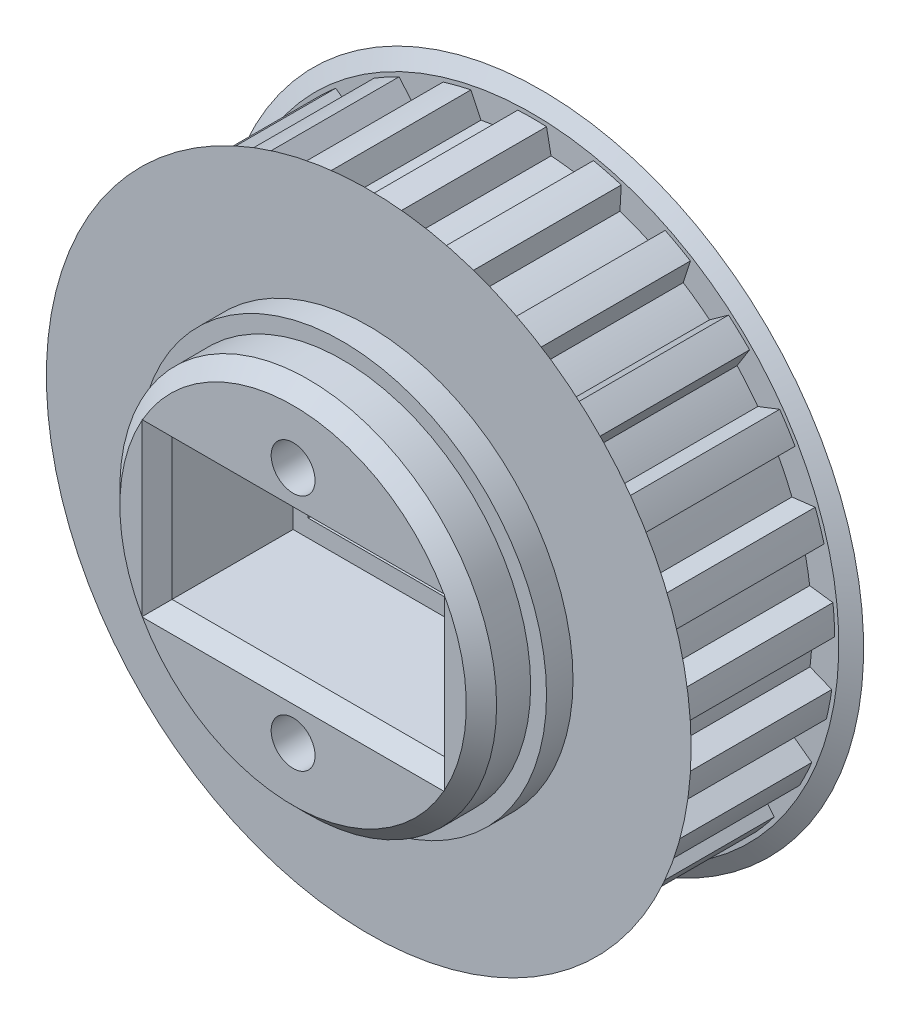
from build123d import *
from build123d.topology import SkipClean

# Parameters (mm, degrees)
CROQUIS1_R                 = 1.5
SALIENTE_EXTRUIR1_DEPTH    = 10.2
CROQUIS2_R                 = 22
CROQUIS2_R_2               = 1.5
SALIENTE_EXTRUIR2_DEPTH    = 0.6
SALIENTE_EXTRUIR4_START    = 4.25
CROQUIS4_R                 = 12.45
CROQUIS4_R_2               = 1.5
SALIENTE_EXTRUIR4_DEPTH    = 4.25
SALIENTE_EXTRUIR6_START    = 0.6
CROQUIS6_R                 = 22
CROQUIS6_R_2               = 1.5
SALIENTE_EXTRUIR6_DEPTH    = 0.6
SALIENTE_EXTRUIR5_START    = 1.75
CROQUIS5_R                 = 13.5
CROQUIS5_R_2               = 1.5
SALIENTE_EXTRUIR5_DEPTH    = 1.75
CHAFL_N2_SIZE              = 1.732050808
CHAFL_N2_SIZE_2            = 1
CROQUIS3_R                 = 12.45
CROQUIS3_R_2               = 1.5
SALIENTE_EXTRUIR7_DEPTH    = 5
CHAFL_N4_SIZE              = 1
CROQUIS7_R                 = 13.5
CROQUIS7_R_2               = 1.5
SALIENTE_EXTRUIR8_DEPTH    = 1.75
CORTAR_EXTRUIR1_DEPTH      = 35.023988766
CORTAR_EXTRUIR1_DEPTH_BACK = 35.023988766
CROQUIS8_R                 = 1.45
CROQUIS8_W                 = 16
CROQUIS8_H                 = 7
CROQUIS10_W                = 18
CROQUIS10_H                = 9.3
CORTAR_EXTRUIR3_DEPTH      = 9
CHAFL_N5_SIZE              = 1
SKETCH1_R                  = 12.45
SKETCH1_R_2                = 1.45
BOSS_EXTRUDE1_DEPTH        = 5
SKETCH2_R                  = 1.45
CUT_EXTRUDE1_DEPTH         = 37.193843559
SKETCH4_W                  = 8
SKETCH4_H                  = 7
CUT_EXTRUDE2_DEPTH         = 21
CHAMFER3_SIZE              = 1
CHAMFER2_SIZE              = 0.75


# Some blends are built 0.0001 mm under size
with BuildPart() as part:
    # Croquis1 → Saliente-Extruir1 (new body)
    with BuildSketch(Plane.XY):
        with BuildLine():
            Line((-0.95, 19.977424759), (-1.25, 18.457721961))
            ThreePointArc((-1.25, 18.457721961), (-2.318664821, 18.354121974), (-3.37951984, 18.188701043))
            Line((-3.37951984, 18.188701043), (-4.048029506, 19.586052617))
            ThreePointArc((-4.048029506, 19.586052617), (-4.973797743, 19.371663223), (-5.888337512, 19.113541831))
            Line((-5.888337512, 19.113541831), (-5.800977743, 17.566976326))
            ThreePointArc((-5.800977743, 17.566976326), (-6.810304225, 17.200864989), (-7.79669202, 16.776817146))
            Line((-7.79669202, 16.776817146), (-8.791706431, 17.964016757))
            ThreePointArc((-8.791706431, 17.964016757), (-9.635073482, 17.526133601), (-10.456689123, 17.048684776))
            Line((-10.456689123, 17.048684776), (-9.98745872, 15.57243296))
            ThreePointArc((-9.98745872, 15.57243296), (-10.874027167, 14.966814396), (-11.723969366, 14.310784126))
            Line((-11.723969366, 14.310784126), (-12.982968107, 15.213235657))
            ThreePointArc((-12.982968107, 15.213235657), (-13.690942119, 14.579372548), (-14.368008499, 13.912596155))
            Line((-14.368008499, 13.912596155), (-13.546390935, 12.599416361))
            ThreePointArc((-13.546390935, 12.599416361), (-14.254494991, 11.79234381), (-14.914586599, 10.945551908))
            Line((-14.914586599, 10.945551908), (-16.358462148, 11.50655101))
            ThreePointArc((-16.358462148, 11.50655101), (-16.88655851, 10.7165359), (-17.376533059, 9.902327951))
            Line((-17.376533059, 9.902327951), (-16.254153587, 8.834732094))
            ThreePointArc((-16.254153587, 8.834732094), (-16.739300471, 7.876916894), (-17.168065504, 6.892570409))
            Line((-17.168065504, 6.892570409), (-18.706093851, 7.076867445))
            ThreePointArc((-18.706093851, 7.076867445), (-19.021130326, 6.180339887), (-19.29322614, 5.269860064))
            Line((-19.29322614, 5.269860064), (-17.94060799, 4.514929118))
            ThreePointArc((-17.94060799, 4.514929118), (-18.172314138, 3.46655432), (-18.342811714, 2.406503362))
            Line((-18.342811714, 2.406503362), (-19.878352881, 2.202518271))
            ThreePointArc((-19.878352881, 2.202518271), (-19.960534569, 1.255810391), (-19.997654868, 0.306267487))
            Line((-19.997654868, 0.306267487), (-18.499788013, -0.088563459))
            ThreePointArc((-18.499788013, -0.088563459), (-18.463494476, -1.161624611), (-18.365011603, -2.230773142))
            Line((-18.365011603, -2.230773142), (-19.801581892, -2.810223225))
            ThreePointArc((-19.801581892, -2.810223225), (-19.645745015, -3.747626292), (-19.445557394, -4.676569002))
            Line((-19.445557394, -4.676569002), (-17.896558317, -4.686491269))
            ThreePointArc((-17.896558317, -4.686491269), (-17.594545551, -5.716814396), (-17.233270272, -6.727881965))
            Line((-17.233270272, -6.727881965), (-18.480604688, -7.646388061))
            ThreePointArc((-18.480604688, -7.646388061), (-18.096541049, -8.515585831), (-17.671624034, -9.365559461))
            Line((-17.671624034, -9.365559461), (-16.168822043, -8.989949596))
            ThreePointArc((-16.168822043, -8.989949596), (-15.620066622, -9.912795707), (-15.01869919, -10.802253221))
            Line((-15.01869919, -10.802253221), (-15.998423124, -12.002102214))
            ThreePointArc((-15.998423124, -12.002102214), (-15.410264856, -12.748479795), (-14.787317543, -13.466077375))
            Line((-14.787317543, -13.466077375), (-13.425139215, -12.728536328))
            ThreePointArc((-13.425139215, -12.728536328), (-12.66412146, -13.485919607), (-11.860448003, -14.197879179))
            Line((-11.860448003, -14.197879179), (-12.511001797, -15.603680144))
            ThreePointArc((-12.511001797, -15.603680144), (-11.755705046, -16.180339887), (-10.973869507, -16.720472124))
            Line((-10.973869507, -16.720472124), (-9.837905517, -15.667342309))
            ThreePointArc((-9.837905517, -15.667342309), (-8.912442971, -16.211673581), (-7.956961248, -16.701400172))
            Line((-7.956961248, -16.701400172), (-8.237468215, -18.224821464))
            ThreePointArc((-8.237468215, -18.224821464), (-7.362491054, -18.595529718), (-6.470892892, -18.924258115))
            Line((-6.470892892, -18.924258115), (-5.632520033, -17.621711554))
            ThreePointArc((-5.632520033, -17.621711554), (-4.600762913, -17.918788481), (-3.553509354, -18.155510769))
            Line((-3.553509354, -18.155510769), (-3.44634421, -19.700830226))
            ThreePointArc((-3.44634421, -19.700830226), (-2.506664671, -19.842294026), (-1.561326277, -19.93896337))
            Line((-1.561326277, -19.93896337), (-1.073222601, -18.468843853))
            ThreePointArc((-1.073222601, -18.468843853), (0, -18.5), (1.073222601, -18.468843853))
            Line((1.073222601, -18.468843853), (1.561326277, -19.93896337))
            ThreePointArc((1.561326277, -19.93896337), (2.506664671, -19.842294026), (3.44634421, -19.700830226))
            Line((3.44634421, -19.700830226), (3.553509354, -18.155510769))
            ThreePointArc((3.553509354, -18.155510769), (4.600762913, -17.918788481), (5.632520033, -17.621711554))
            Line((5.632520033, -17.621711554), (6.470892892, -18.924258115))
            ThreePointArc((6.470892892, -18.924258115), (7.362491054, -18.595529718), (8.237468215, -18.224821464))
            Line((8.237468215, -18.224821464), (7.956961248, -16.701400172))
            ThreePointArc((7.956961248, -16.701400172), (8.912442971, -16.211673581), (9.837905517, -15.667342309))
            Line((9.837905517, -15.667342309), (10.973869507, -16.720472124))
            ThreePointArc((10.973869507, -16.720472124), (11.755705046, -16.180339887), (12.511001797, -15.603680144))
            Line((12.511001797, -15.603680144), (11.860448003, -14.197879179))
            ThreePointArc((11.860448003, -14.197879179), (12.66412146, -13.485919607), (13.425139215, -12.728536328))
            Line((13.425139215, -12.728536328), (14.787317543, -13.466077375))
            ThreePointArc((14.787317543, -13.466077375), (15.410264856, -12.748479795), (15.998423124, -12.002102214))
            Line((15.998423124, -12.002102214), (15.01869919, -10.802253221))
            ThreePointArc((15.01869919, -10.802253221), (15.620066622, -9.912795707), (16.168822043, -8.989949596))
            Line((16.168822043, -8.989949596), (17.671624034, -9.365559461))
            ThreePointArc((17.671624034, -9.365559461), (18.096541049, -8.515585831), (18.480604688, -7.646388061))
            Line((18.480604688, -7.646388061), (17.233270272, -6.727881965))
            ThreePointArc((17.233270272, -6.727881965), (17.594545551, -5.716814396), (17.896558317, -4.686491269))
            Line((17.896558317, -4.686491269), (19.445557394, -4.676569002))
            ThreePointArc((19.445557394, -4.676569002), (19.645745015, -3.747626292), (19.801581892, -2.810223225))
            Line((19.801581892, -2.810223225), (18.365011603, -2.230773142))
            ThreePointArc((18.365011603, -2.230773142), (18.463494476, -1.161624611), (18.499788013, -0.088563459))
            Line((18.499788013, -0.088563459), (19.997654868, 0.306267487))
            ThreePointArc((19.997654868, 0.306267487), (19.960534569, 1.255810391), (19.878352881, 2.202518271))
            Line((19.878352881, 2.202518271), (18.342811714, 2.406503362))
            ThreePointArc((18.342811714, 2.406503362), (18.172314138, 3.46655432), (17.94060799, 4.514929118))
            Line((17.94060799, 4.514929118), (19.29322614, 5.269860064))
            ThreePointArc((19.29322614, 5.269860064), (19.021130326, 6.180339887), (18.706093851, 7.076867445))
            Line((18.706093851, 7.076867445), (17.168065504, 6.892570409))
            ThreePointArc((17.168065504, 6.892570409), (16.739300471, 7.876916894), (16.254153587, 8.834732094))
            Line((16.254153587, 8.834732094), (17.376533059, 9.902327951))
            ThreePointArc((17.376533059, 9.902327951), (16.88655851, 10.7165359), (16.358462148, 11.50655101))
            Line((16.358462148, 11.50655101), (14.914586599, 10.945551908))
            ThreePointArc((14.914586599, 10.945551908), (14.254494991, 11.79234381), (13.546390935, 12.599416361))
            Line((13.546390935, 12.599416361), (14.368008499, 13.912596155))
            ThreePointArc((14.368008499, 13.912596155), (13.690942119, 14.579372548), (12.982968107, 15.213235657))
            Line((12.982968107, 15.213235657), (11.723969366, 14.310784126))
            ThreePointArc((11.723969366, 14.310784126), (10.874027167, 14.966814396), (9.98745872, 15.57243296))
            Line((9.98745872, 15.57243296), (10.456689123, 17.048684776))
            ThreePointArc((10.456689123, 17.048684776), (9.635073482, 17.526133601), (8.791706431, 17.964016757))
            Line((8.791706431, 17.964016757), (7.79669202, 16.776817146))
            ThreePointArc((7.79669202, 16.776817146), (6.810304225, 17.200864989), (5.800977743, 17.566976326))
            Line((5.800977743, 17.566976326), (5.888337512, 19.113541831))
            ThreePointArc((5.888337512, 19.113541831), (4.973797743, 19.371663223), (4.048029506, 19.586052617))
            Line((4.048029506, 19.586052617), (3.37951984, 18.188701043))
            ThreePointArc((3.37951984, 18.188701043), (2.318664821, 18.354121974), (1.25, 18.457721961))
            Line((1.25, 18.457721961), (0.95, 19.977424759))
            ThreePointArc((0.95, 19.977424759), (0, 20), (-0.95, 19.977424759))
        make_face()
        Circle(CROQUIS1_R, mode=Mode.SUBTRACT)
    extrude(amount=SALIENTE_EXTRUIR1_DEPTH)

    # Croquis2 → Saliente-Extruir2 (add)
    with BuildSketch(Plane.XY.offset(10.2)):
        Circle(CROQUIS2_R)
        Circle(CROQUIS2_R_2, mode=Mode.SUBTRACT)
    extrude(amount=SALIENTE_EXTRUIR2_DEPTH)

    # Croquis4 → Saliente-Extruir4 (add)
    with BuildSketch(Plane(origin=(0, 0, 0), x_dir=(-1, 0, 0), z_dir=(0, 0, -1)).offset(SALIENTE_EXTRUIR4_START)):
        with Locations(Location((0, 0, 0), (0, 0, 180))):
            Circle(CROQUIS4_R)
        Circle(CROQUIS4_R_2, mode=Mode.SUBTRACT)
    extrude(amount=-SALIENTE_EXTRUIR4_DEPTH)

    # Croquis6 → Saliente-Extruir6 (add)
    with SkipClean():  # the faces are left unmerged after this step: merging them gives an invalid solid
        with BuildSketch(Plane(origin=(0, 0, 0), x_dir=(-1, 0, 0), z_dir=(0, 0, -1)).offset(SALIENTE_EXTRUIR6_START)):
            with Locations(Location((0, 0, 0), (0, 0, 180))):
                Circle(CROQUIS6_R)
            Circle(CROQUIS6_R_2, mode=Mode.SUBTRACT)
        extrude(amount=-SALIENTE_EXTRUIR6_DEPTH)

    # Croquis5 → Saliente-Extruir5 (add)
    with SkipClean():  # the faces are left unmerged after this step: merging them gives an invalid solid
        with BuildSketch(Plane(origin=(0, 0, -0.6), x_dir=(-1, 0, 0), z_dir=(0, 0, -1)).offset(SALIENTE_EXTRUIR5_START)):
            Circle(CROQUIS5_R)
            Circle(CROQUIS5_R_2, mode=Mode.SUBTRACT)
        extrude(amount=-SALIENTE_EXTRUIR5_DEPTH)

    # Chaflán2
    # the kernel refuses this chamfer: 1.732050808, 1 mm, written as the material it takes off along each edge
    with BuildSketch(Plane(origin=(0, 0, 0), x_dir=(1, 0, 0), z_dir=(0, 1, 0))) as chafl_n2_piece_1:
        Polygon((22 - CHAFL_N2_SIZE, 0), (22, CHAFL_N2_SIZE_2), (22, 0), align=None)
    revolve(axis=Axis((0, 0, 0), (0, 0, -1)), mode=Mode.SUBTRACT)
    with BuildSketch(Plane(origin=(0, 0, 10.2), x_dir=(1, 0, 0), z_dir=(0, -1, 0))) as chafl_n2_piece_2:
        Polygon((22 - CHAFL_N2_SIZE, 0), (22, CHAFL_N2_SIZE_2), (22, 0), align=None)
    revolve(axis=Axis((0, 0, 10.2), (0, 0, 1)), mode=Mode.SUBTRACT)

    # Croquis3 → Saliente-Extruir7 (add)
    with BuildSketch(Plane.XY.offset(10.8)):
        with Locations(Location((0, 0, 0), (0, 0, 180))):
            Circle(CROQUIS3_R)
        with Locations(Location((0, 0, 0), (0, 0, 180))):
            Circle(CROQUIS3_R_2, mode=Mode.SUBTRACT)
    extrude(amount=SALIENTE_EXTRUIR7_DEPTH)

    # Chaflán4
    chafl_n4_edges = [part.edges().sort_by_distance(p)[0] for p in [
        (12.45, 0, 15.8),
    ]]
    chamfer(chafl_n4_edges, length=CHAFL_N4_SIZE)

    # Croquis7 → Saliente-Extruir8 (add)
    with BuildSketch(Plane.XY.offset(10.8)):
        with Locations(Location((0, 0, 0), (0, 0, 180))):
            Circle(CROQUIS7_R)
        with Locations(Location((0, 0, 0), (0, 0, 180))):
            Circle(CROQUIS7_R_2, mode=Mode.SUBTRACT)
    extrude(amount=SALIENTE_EXTRUIR8_DEPTH)

    # Croquis8 → Cortar-Extruir1 (cut, two sides: drawn at the far end of the back side and taken through both)
    with BuildSketch(Plane.XY.offset(-CORTAR_EXTRUIR1_DEPTH_BACK)):
        with Locations((0, 7.875631857)):
            Circle(CROQUIS8_R)
        with Locations((0, -7.875631857)):
            Circle(CROQUIS8_R)
        Rectangle(CROQUIS8_W, CROQUIS8_H)
    extrude(amount=CORTAR_EXTRUIR1_DEPTH + CORTAR_EXTRUIR1_DEPTH_BACK, mode=Mode.SUBTRACT)

    # Croquis10 → Cortar-Extruir3 (cut)
    with BuildSketch(Plane.XY.offset(15.8)):
        Rectangle(CROQUIS10_W, CROQUIS10_H)
    extrude(amount=-CORTAR_EXTRUIR3_DEPTH, mode=Mode.SUBTRACT)

    # Chaflán5
    # the kernel refuses this chamfer: 1 mm, written as the material it takes off along each edge
    with BuildSketch(Plane(origin=(8, 3.5, -4.25), x_dir=(0.9996219169112968, 0, -0.02749587661058651), z_dir=(0, -1, 0)), Plane(origin=(-8, -3.5, -4.25), x_dir=(-0.9996219169112968, 0, -0.02749587661058651), z_dir=(0, 1, 0))) as chafl_n5_piece_1:
        Polygon((CHAFL_N5_SIZE * 0.999621916911, CHAFL_N5_SIZE * 0.0274958766106), (-CHAFL_N5_SIZE * 0.0274958766106, CHAFL_N5_SIZE * 0.999621916911), (0, 0), align=None)
    extrude(amount=7, mode=Mode.SUBTRACT)
    with BuildSketch(Plane(origin=(8, -3.5, -4.25), x_dir=(0, -0.9996219169112968, -0.027495876610586497), z_dir=(-1, 0, 0)), Plane(origin=(-8, 3.5, -4.25), x_dir=(0, 0.9996219169112968, -0.027495876610586487), z_dir=(1, 0, 0))) as chafl_n5_piece_2:
        Polygon((CHAFL_N5_SIZE * 0.999621916911, CHAFL_N5_SIZE * 0.0274958766106), (-CHAFL_N5_SIZE * 0.0274958766106, CHAFL_N5_SIZE * 0.999621916911), (0, 0), align=None)
    extrude(amount=16, mode=Mode.SUBTRACT)
    with BuildSketch(Plane(origin=(-9, 4.65, 15.8), x_dir=(-0.9996219169112968, 0, 0.027495876610585647), z_dir=(0, -1, 0)), Plane(origin=(9, -4.65, 15.8), x_dir=(0.9996219169112968, 0, 0.027495876610585647), z_dir=(0, 1, 0))) as chafl_n5_piece_3:
        Polygon((CHAFL_N5_SIZE * 0.999621916911, CHAFL_N5_SIZE * 0.0274958766106), (-CHAFL_N5_SIZE * 0.0274958766106, CHAFL_N5_SIZE * 0.999621916911), (0, 0), align=None)
    extrude(amount=9.3, mode=Mode.SUBTRACT)
    with BuildSketch(Plane(origin=(-9, -4.65, 15.8), x_dir=(0, -0.9996219169112968, 0.027495876610585623), z_dir=(1, 0, 0)), Plane(origin=(9, 4.65, 15.8), x_dir=(0, 0.9996219169112968, 0.027495876610585623), z_dir=(-1, 0, 0))) as chafl_n5_piece_4:
        Polygon((CHAFL_N5_SIZE * 0.999621916911, CHAFL_N5_SIZE * 0.0274958766106), (-CHAFL_N5_SIZE * 0.0274958766106, CHAFL_N5_SIZE * 0.999621916911), (0, 0), align=None)
    extrude(amount=18, mode=Mode.SUBTRACT)
    with BuildSketch(Plane(origin=(-8, 3.5, -4.25), x_dir=(0, 0.9996219169112968, -0.027495876610586487), z_dir=(1, 0, 0))) as chafl_n5_piece_5a_section:
        Polygon((CHAFL_N5_SIZE * 0.999621916911, CHAFL_N5_SIZE * 0.0274958766106), (-CHAFL_N5_SIZE * 0.0274958766106, CHAFL_N5_SIZE * 0.999621916911), (0, 0), align=None)
    chafl_n5_piece_5a = extrude(amount=18.571682988, mode=Mode.PRIVATE)
    chafl_n5_piece_5a = split(chafl_n5_piece_5a, bisect_by=Plane(origin=(8, 3.829793627, -3.920206373), z_dir=(1, 0, 0)), keep=Keep.TOP, mode=Mode.PRIVATE)
    with BuildSketch(Plane(origin=(8, 6.071682988, -4.25), x_dir=(0.9996219169112968, 0, -0.02749587661058651), z_dir=(0, -1, 0))) as chafl_n5_piece_5b_section:
        Polygon((CHAFL_N5_SIZE * 0.999621916911, CHAFL_N5_SIZE * 0.0274958766106), (-CHAFL_N5_SIZE * 0.0274958766106, CHAFL_N5_SIZE * 0.999621916911), (0, 0), align=None)
    chafl_n5_piece_5b = extrude(amount=9.571682988, mode=Mode.PRIVATE)
    chafl_n5_piece_5b = split(chafl_n5_piece_5b, bisect_by=Plane(origin=(8.329793627, 3.5, -3.920206373), z_dir=(0, 1, 0)), keep=Keep.TOP, mode=Mode.PRIVATE)
    chafl_n5_piece_5 = chafl_n5_piece_5a & chafl_n5_piece_5b
    add(chafl_n5_piece_5, mode=Mode.SUBTRACT)
    with BuildSketch(Plane(origin=(8, 3.5, -4.25), x_dir=(0.9996219169112968, 0, -0.02749587661058651), z_dir=(0, -1, 0))) as chafl_n5_piece_6a_section:
        Polygon((CHAFL_N5_SIZE * 0.999621916911, CHAFL_N5_SIZE * 0.0274958766106), (-CHAFL_N5_SIZE * 0.0274958766106, CHAFL_N5_SIZE * 0.999621916911), (0, 0), align=None)
    chafl_n5_piece_6a = extrude(amount=9.571682988, mode=Mode.PRIVATE)
    chafl_n5_piece_6a = split(chafl_n5_piece_6a, bisect_by=Plane(origin=(8.329793627, -3.5, -3.920206373), z_dir=(0, -1, 0)), keep=Keep.TOP, mode=Mode.PRIVATE)
    with BuildSketch(Plane(origin=(10.571682988, -3.5, -4.25), x_dir=(0, -0.9996219169112968, -0.027495876610586497), z_dir=(-1, 0, 0))) as chafl_n5_piece_6b_section:
        Polygon((CHAFL_N5_SIZE * 0.999621916911, CHAFL_N5_SIZE * 0.0274958766106), (-CHAFL_N5_SIZE * 0.0274958766106, CHAFL_N5_SIZE * 0.999621916911), (0, 0), align=None)
    chafl_n5_piece_6b = extrude(amount=18.571682988, mode=Mode.PRIVATE)
    chafl_n5_piece_6b = split(chafl_n5_piece_6b, bisect_by=Plane(origin=(8, -3.829793627, -3.920206373), z_dir=(1, 0, 0)), keep=Keep.TOP, mode=Mode.PRIVATE)
    chafl_n5_piece_6 = chafl_n5_piece_6a & chafl_n5_piece_6b
    add(chafl_n5_piece_6, mode=Mode.SUBTRACT)
    with BuildSketch(Plane(origin=(8, -3.5, -4.25), x_dir=(0, -0.9996219169112968, -0.027495876610586497), z_dir=(-1, 0, 0))) as chafl_n5_piece_7a_section:
        Polygon((CHAFL_N5_SIZE * 0.999621916911, CHAFL_N5_SIZE * 0.0274958766106), (-CHAFL_N5_SIZE * 0.0274958766106, CHAFL_N5_SIZE * 0.999621916911), (0, 0), align=None)
    chafl_n5_piece_7a = extrude(amount=18.571682988, mode=Mode.PRIVATE)
    chafl_n5_piece_7a = split(chafl_n5_piece_7a, bisect_by=Plane(origin=(-8, -3.829793627, -3.920206373), z_dir=(-1, 0, 0)), keep=Keep.TOP, mode=Mode.PRIVATE)
    with BuildSketch(Plane(origin=(-8, -6.071682988, -4.25), x_dir=(-0.9996219169112968, 0, -0.02749587661058651), z_dir=(0, 1, 0))) as chafl_n5_piece_7b_section:
        Polygon((CHAFL_N5_SIZE * 0.999621916911, CHAFL_N5_SIZE * 0.0274958766106), (-CHAFL_N5_SIZE * 0.0274958766106, CHAFL_N5_SIZE * 0.999621916911), (0, 0), align=None)
    chafl_n5_piece_7b = extrude(amount=9.571682988, mode=Mode.PRIVATE)
    chafl_n5_piece_7b = split(chafl_n5_piece_7b, bisect_by=Plane(origin=(-8.329793627, -3.5, -3.920206373), z_dir=(0, -1, 0)), keep=Keep.TOP, mode=Mode.PRIVATE)
    chafl_n5_piece_7 = chafl_n5_piece_7a & chafl_n5_piece_7b
    add(chafl_n5_piece_7, mode=Mode.SUBTRACT)
    with BuildSketch(Plane(origin=(-10.571682988, 3.5, -4.25), x_dir=(0, 0.9996219169112968, -0.027495876610586487), z_dir=(1, 0, 0))) as chafl_n5_piece_8a_section:
        Polygon((CHAFL_N5_SIZE * 0.999621916911, CHAFL_N5_SIZE * 0.0274958766106), (-CHAFL_N5_SIZE * 0.0274958766106, CHAFL_N5_SIZE * 0.999621916911), (0, 0), align=None)
    chafl_n5_piece_8a = extrude(amount=18.571682988, mode=Mode.PRIVATE)
    chafl_n5_piece_8a = split(chafl_n5_piece_8a, bisect_by=Plane(origin=(-8, 3.829793627, -3.920206373), z_dir=(-1, 0, 0)), keep=Keep.TOP, mode=Mode.PRIVATE)
    with BuildSketch(Plane(origin=(-8, -3.5, -4.25), x_dir=(-0.9996219169112968, 0, -0.02749587661058651), z_dir=(0, 1, 0))) as chafl_n5_piece_8b_section:
        Polygon((CHAFL_N5_SIZE * 0.999621916911, CHAFL_N5_SIZE * 0.0274958766106), (-CHAFL_N5_SIZE * 0.0274958766106, CHAFL_N5_SIZE * 0.999621916911), (0, 0), align=None)
    chafl_n5_piece_8b = extrude(amount=9.571682988, mode=Mode.PRIVATE)
    chafl_n5_piece_8b = split(chafl_n5_piece_8b, bisect_by=Plane(origin=(-8.329793627, 3.5, -3.920206373), z_dir=(0, 1, 0)), keep=Keep.TOP, mode=Mode.PRIVATE)
    chafl_n5_piece_8 = chafl_n5_piece_8a & chafl_n5_piece_8b
    add(chafl_n5_piece_8, mode=Mode.SUBTRACT)
    with BuildSketch(Plane(origin=(9, 4.65, 15.8), x_dir=(0, 0.9996219169112968, 0.027495876610585623), z_dir=(-1, 0, 0))) as chafl_n5_piece_9a_section:
        Polygon((CHAFL_N5_SIZE * 0.999621916911, CHAFL_N5_SIZE * 0.0274958766106), (-CHAFL_N5_SIZE * 0.0274958766106, CHAFL_N5_SIZE * 0.999621916911), (0, 0), align=None)
    chafl_n5_piece_9a = extrude(amount=20.571682988, mode=Mode.PRIVATE)
    chafl_n5_piece_9a = split(chafl_n5_piece_9a, bisect_by=Plane(origin=(-9, 4.979793627, 15.470206373), z_dir=(-1, 0, 0)), keep=Keep.TOP, mode=Mode.PRIVATE)
    with BuildSketch(Plane(origin=(-9, 7.221682988, 15.8), x_dir=(-0.9996219169112968, 0, 0.027495876610585647), z_dir=(0, -1, 0))) as chafl_n5_piece_9b_section:
        Polygon((CHAFL_N5_SIZE * 0.999621916911, CHAFL_N5_SIZE * 0.0274958766106), (-CHAFL_N5_SIZE * 0.0274958766106, CHAFL_N5_SIZE * 0.999621916911), (0, 0), align=None)
    chafl_n5_piece_9b = extrude(amount=11.871682988, mode=Mode.PRIVATE)
    chafl_n5_piece_9b = split(chafl_n5_piece_9b, bisect_by=Plane(origin=(-9.329793627, 4.65, 15.470206373), z_dir=(0, 1, 0)), keep=Keep.TOP, mode=Mode.PRIVATE)
    chafl_n5_piece_9 = chafl_n5_piece_9a & chafl_n5_piece_9b
    add(chafl_n5_piece_9, mode=Mode.SUBTRACT)
    with BuildSketch(Plane(origin=(-9, 4.65, 15.8), x_dir=(-0.9996219169112968, 0, 0.027495876610585647), z_dir=(0, -1, 0))) as chafl_n5_piece_10a_section:
        Polygon((CHAFL_N5_SIZE * 0.999621916911, CHAFL_N5_SIZE * 0.0274958766106), (-CHAFL_N5_SIZE * 0.0274958766106, CHAFL_N5_SIZE * 0.999621916911), (0, 0), align=None)
    chafl_n5_piece_10a = extrude(amount=11.871682988, mode=Mode.PRIVATE)
    chafl_n5_piece_10a = split(chafl_n5_piece_10a, bisect_by=Plane(origin=(-9.329793627, -4.65, 15.470206373), z_dir=(0, -1, 0)), keep=Keep.TOP, mode=Mode.PRIVATE)
    with BuildSketch(Plane(origin=(-11.571682988, -4.65, 15.8), x_dir=(0, -0.9996219169112968, 0.027495876610585623), z_dir=(1, 0, 0))) as chafl_n5_piece_10b_section:
        Polygon((CHAFL_N5_SIZE * 0.999621916911, CHAFL_N5_SIZE * 0.0274958766106), (-CHAFL_N5_SIZE * 0.0274958766106, CHAFL_N5_SIZE * 0.999621916911), (0, 0), align=None)
    chafl_n5_piece_10b = extrude(amount=20.571682988, mode=Mode.PRIVATE)
    chafl_n5_piece_10b = split(chafl_n5_piece_10b, bisect_by=Plane(origin=(-9, -4.979793627, 15.470206373), z_dir=(-1, 0, 0)), keep=Keep.TOP, mode=Mode.PRIVATE)
    chafl_n5_piece_10 = chafl_n5_piece_10a & chafl_n5_piece_10b
    add(chafl_n5_piece_10, mode=Mode.SUBTRACT)
    with BuildSketch(Plane(origin=(-9, -4.65, 15.8), x_dir=(0, -0.9996219169112968, 0.027495876610585623), z_dir=(1, 0, 0))) as chafl_n5_piece_11a_section:
        Polygon((CHAFL_N5_SIZE * 0.999621916911, CHAFL_N5_SIZE * 0.0274958766106), (-CHAFL_N5_SIZE * 0.0274958766106, CHAFL_N5_SIZE * 0.999621916911), (0, 0), align=None)
    chafl_n5_piece_11a = extrude(amount=20.571682988, mode=Mode.PRIVATE)
    chafl_n5_piece_11a = split(chafl_n5_piece_11a, bisect_by=Plane(origin=(9, -4.979793627, 15.470206373), z_dir=(1, 0, 0)), keep=Keep.TOP, mode=Mode.PRIVATE)
    with BuildSketch(Plane(origin=(9, -7.221682988, 15.8), x_dir=(0.9996219169112968, 0, 0.027495876610585647), z_dir=(0, 1, 0))) as chafl_n5_piece_11b_section:
        Polygon((CHAFL_N5_SIZE * 0.999621916911, CHAFL_N5_SIZE * 0.0274958766106), (-CHAFL_N5_SIZE * 0.0274958766106, CHAFL_N5_SIZE * 0.999621916911), (0, 0), align=None)
    chafl_n5_piece_11b = extrude(amount=11.871682988, mode=Mode.PRIVATE)
    chafl_n5_piece_11b = split(chafl_n5_piece_11b, bisect_by=Plane(origin=(9.329793627, -4.65, 15.470206373), z_dir=(0, -1, 0)), keep=Keep.TOP, mode=Mode.PRIVATE)
    chafl_n5_piece_11 = chafl_n5_piece_11a & chafl_n5_piece_11b
    add(chafl_n5_piece_11, mode=Mode.SUBTRACT)
    with BuildSketch(Plane(origin=(11.571682988, 4.65, 15.8), x_dir=(0, 0.9996219169112968, 0.027495876610585623), z_dir=(-1, 0, 0))) as chafl_n5_piece_12a_section:
        Polygon((CHAFL_N5_SIZE * 0.999621916911, CHAFL_N5_SIZE * 0.0274958766106), (-CHAFL_N5_SIZE * 0.0274958766106, CHAFL_N5_SIZE * 0.999621916911), (0, 0), align=None)
    chafl_n5_piece_12a = extrude(amount=20.571682988, mode=Mode.PRIVATE)
    chafl_n5_piece_12a = split(chafl_n5_piece_12a, bisect_by=Plane(origin=(9, 4.979793627, 15.470206373), z_dir=(1, 0, 0)), keep=Keep.TOP, mode=Mode.PRIVATE)
    with BuildSketch(Plane(origin=(9, -4.65, 15.8), x_dir=(0.9996219169112968, 0, 0.027495876610585647), z_dir=(0, 1, 0))) as chafl_n5_piece_12b_section:
        Polygon((CHAFL_N5_SIZE * 0.999621916911, CHAFL_N5_SIZE * 0.0274958766106), (-CHAFL_N5_SIZE * 0.0274958766106, CHAFL_N5_SIZE * 0.999621916911), (0, 0), align=None)
    chafl_n5_piece_12b = extrude(amount=11.871682988, mode=Mode.PRIVATE)
    chafl_n5_piece_12b = split(chafl_n5_piece_12b, bisect_by=Plane(origin=(9.329793627, 4.65, 15.470206373), z_dir=(0, 1, 0)), keep=Keep.TOP, mode=Mode.PRIVATE)
    chafl_n5_piece_12 = chafl_n5_piece_12a & chafl_n5_piece_12b
    add(chafl_n5_piece_12, mode=Mode.SUBTRACT)

    # Sketch1 → Boss-Extrude1 (add)
    with BuildSketch(Plane(origin=(0, 0, -4.25), x_dir=(-1, 0, 0), z_dir=(0, 0, -1))):
        Circle(SKETCH1_R)
        with Locations(Location((0, 7.875631857, 0), (0, 0, 180))):
            Circle(SKETCH1_R_2, mode=Mode.SUBTRACT)
        with Locations(Location((0, -7.875631857, 0), (0, 0, 180))):
            Circle(SKETCH1_R_2, mode=Mode.SUBTRACT)
    extrude(amount=-BOSS_EXTRUDE1_DEPTH)

    # Sketch2 → Cut-Extrude1 (cut, through all)
    with BuildSketch(Plane(origin=(0, 0, -4.25), x_dir=(-1, 0, 0), z_dir=(0, 0, -1))):
        with Locations((-7.5, 0)):
            Circle(SKETCH2_R)
        with Locations(Location((7.5, 0, 0), (0, 0, 69.828728654))):
            Circle(SKETCH2_R)
    extrude(amount=-CUT_EXTRUDE1_DEPTH, mode=Mode.SUBTRACT)

    # Sketch4 → Cut-Extrude2 (cut)
    with BuildSketch(Plane.XY.offset(15.8)):
        Rectangle(SKETCH4_W, SKETCH4_H)
    extrude(amount=-CUT_EXTRUDE2_DEPTH, mode=Mode.SUBTRACT)

    # Chamfer3
    chamfer3_edges = [part.edges().sort_by_distance(p)[0] for p in [
        (-4, 0, -4.25),
        (0, 3.5, -4.25),
        (4, 0, -4.25),
        (0, -3.5, -4.25),
    ]]
    chamfer(chamfer3_edges, length=CHAMFER3_SIZE - 0.0001)  # a hair under: the kernel refuses the full size

    # Chamfer2
    chamfer2_edges = [part.edges().sort_by_distance(p)[0] for p in [
        (-12.45, 0, -4.25),
    ]]
    chamfer(chamfer2_edges, length=CHAMFER2_SIZE)


solid = part.part
